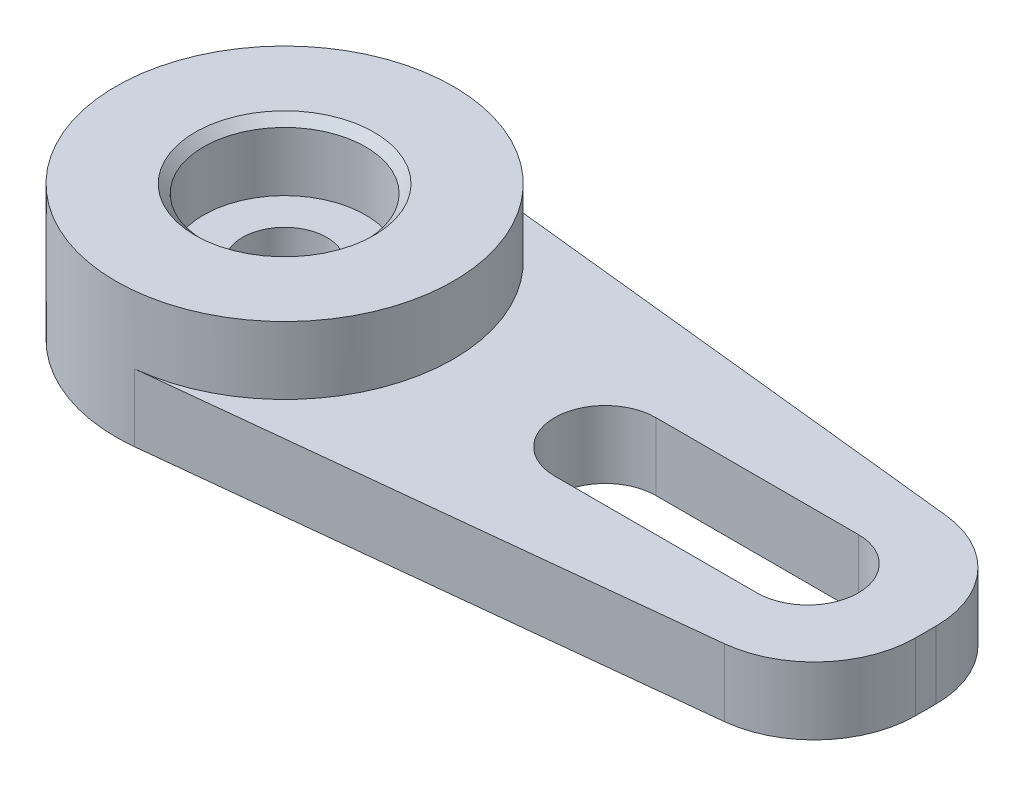
from build123d import *

# Parameters (mm, degrees)
SKETCH1_R           = 1.25
BOSS_EXTRUDE1_DEPTH = 2
SKETCH2_R           = 5
SKETCH2_R_2         = 1.25
BOSS_EXTRUDE2_DEPTH = 2
CUT_EXTRUDE1_START  = -2
SKETCH3_R           = 2.4
SKETCH3_R_2         = 1.25
CUT_EXTRUDE1_DEPTH  = 2
CHAMFER1_SIZE       = 0.25
CUT_EXTRUDE2_DEPTH  = 3
FILLET1_R           = 3


with BuildPart() as part:
    # Sketch1 → Boss-Extrude1 (new body)
    with BuildSketch(Plane(origin=(0, 0, 0), x_dir=(1, 0, 0), z_dir=(0, 1, 0))):
        with BuildLine():
            ThreePointArc((0.530776664, 4.971747795), (-5, 0), (0.530776664, -4.971747795))
            Line((0.530776664, -4.971747795), (19, -3))
            Line((19, -3), (19, 3))
            Line((19, 3), (0.530776664, 4.971747795))
        make_face()
        Circle(SKETCH1_R, mode=Mode.SUBTRACT)
    extrude(amount=BOSS_EXTRUDE1_DEPTH)

    # Sketch2 → Boss-Extrude2 (add)
    with BuildSketch(Plane(origin=(0, 2, 0), x_dir=(1, 0, 0), z_dir=(0, 1, 0))):
        Circle(SKETCH2_R)
        Circle(SKETCH2_R_2, mode=Mode.SUBTRACT)
    extrude(amount=BOSS_EXTRUDE2_DEPTH)

    # Sketch3 → Cut-Extrude1 (cut)
    with BuildSketch(Plane(origin=(0, 4, 0), x_dir=(1, 0, 0), z_dir=(0, 1, 0)).offset(CUT_EXTRUDE1_START)):
        Circle(SKETCH3_R)
        Circle(SKETCH3_R_2, mode=Mode.SUBTRACT)
    extrude(amount=CUT_EXTRUDE1_DEPTH, mode=Mode.SUBTRACT)

    # Chamfer1
    chamfer1_edges = [part.edges().sort_by_distance(p)[0] for p in [
        (-2.4, 4, 0),
    ]]
    chamfer(chamfer1_edges, length=CHAMFER1_SIZE)

    # Sketch4 → Cut-Extrude2 (cut)
    with BuildSketch(Plane(origin=(0, 2, 0), x_dir=(1, 0, 0), z_dir=(0, 1, 0))):
        with BuildLine():
            Line((9.5, 1.5), (15.5, 1.5))
            ThreePointArc((15.5, 1.5), (17, 0), (15.5, -1.5))
            Line((15.5, -1.5), (9.5, -1.5))
            ThreePointArc((9.5, -1.5), (8, 0), (9.5, 1.5))
        make_face()
    extrude(amount=-CUT_EXTRUDE2_DEPTH, mode=Mode.SUBTRACT)

    # Fillet1
    fillet1_edges = [part.edges().sort_by_distance(p)[0] for p in [
        (19, 1, 3),
        (19, 1, -3),
    ]]
    fillet(fillet1_edges, radius=FILLET1_R)


solid = part.part
